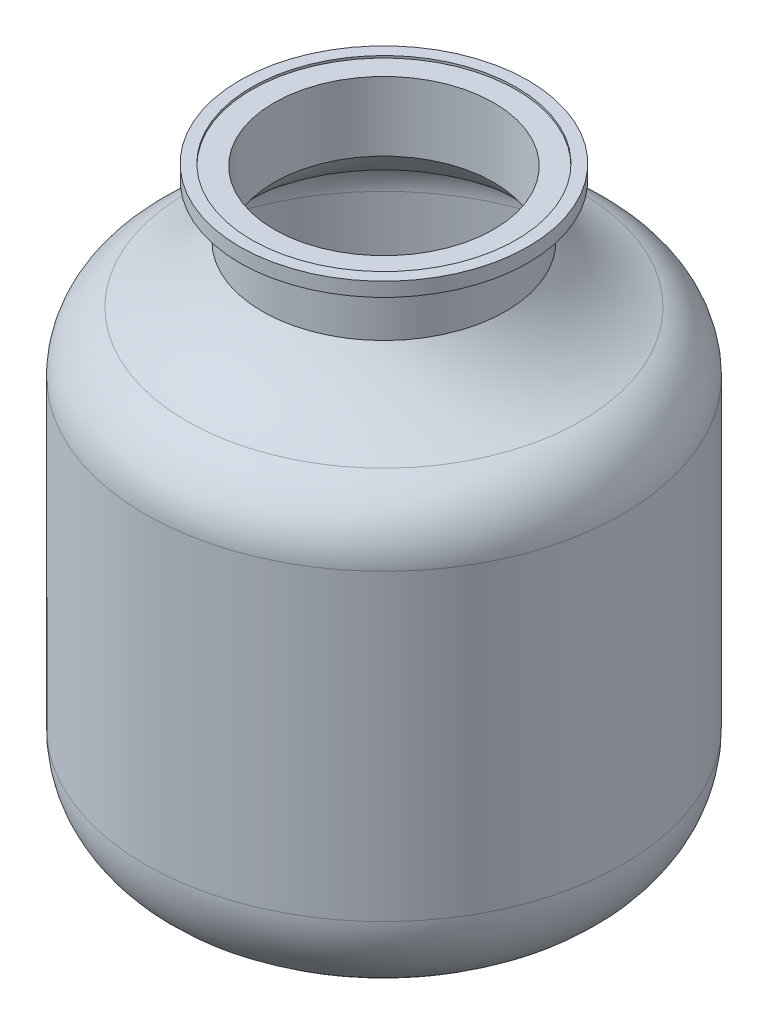
from build123d import *


# Read off the part's stored shape, not the designer's step: Shell1
with BuildPart() as part:
    # Sketch1 → Revolve1 (revolve)
    with BuildSketch(Plane.XY, mode=Mode.PRIVATE) as revolve1_sk:
        with BuildLine():
            Line((0, 0), (24.360145845, 0))
            ThreePointArc((24.360145845, 0), (35.651483834, 4.677025332), (40.328509165, 15.96836332))
            Line((40.328509165, 15.96836332), (40.328509165, 67.23016629))
            ThreePointArc((40.328509165, 67.23016629), (38.415383352, 73.392914659), (33.348649325, 77.388878138))
            ThreePointArc((33.348649325, 77.388878138), (26.276782154, 81.308753559), (20.55607493, 87.022792188))
            Line((20.55607493, 87.022792188), (20.55607493, 96.024974169))
            Line((20.55607493, 96.024974169), (24.360145845, 96.024974169))
            Line((24.360145845, 96.024974169), (24.360145845, 98.393969428))
            Line((24.360145845, 98.393969428), (0, 98.393969428))
            Line((0, 98.393969428), (0, 0))
        make_face()
    revolve(revolve1_sk.sketch.rotate(Axis((0, 98.393969428, 0), (0, -1, 0)), 90), axis=Axis((0, 98.393969428, 0), (0, -1, 0)))

    # Shell1 outline → Shell1 (revolve, cut)
    with BuildSketch(Plane.XY):
        with BuildLine():
            Line((24.360145845, 0), (24.360145845, 2))
            ThreePointArc((24.360145845, 2), (34.237270271, 6.091238894), (38.328509165, 15.96836332))
            Line((38.328509165, 15.96836332), (38.328509165, 67.23016629))
            ThreePointArc((38.328509165, 67.23016629), (36.766977277, 72.260325849), (32.631406737, 75.521911864))
            ThreePointArc((32.631406737, 75.521911864), (24.803132334, 79.91715704), (18.55607493, 86.364973266))
            Line((18.55607493, 86.364973266), (18.55607493, 98.024974169))
            Line((18.55607493, 98.024974169), (22.360145845, 98.024974169))
            Line((22.360145845, 98.024974169), (22.360145845, 98.393969428))
            Line((22.360145845, 98.393969428), (0, 98.393969428))
            Line((0, 98.393969428), (0, 0))
            Line((0, 0), (24.360145845, 0))
        make_face()
    revolve(axis=Axis((0, 0, 0), (0, 1, 0)), mode=Mode.SUBTRACT)


solid = part.part
